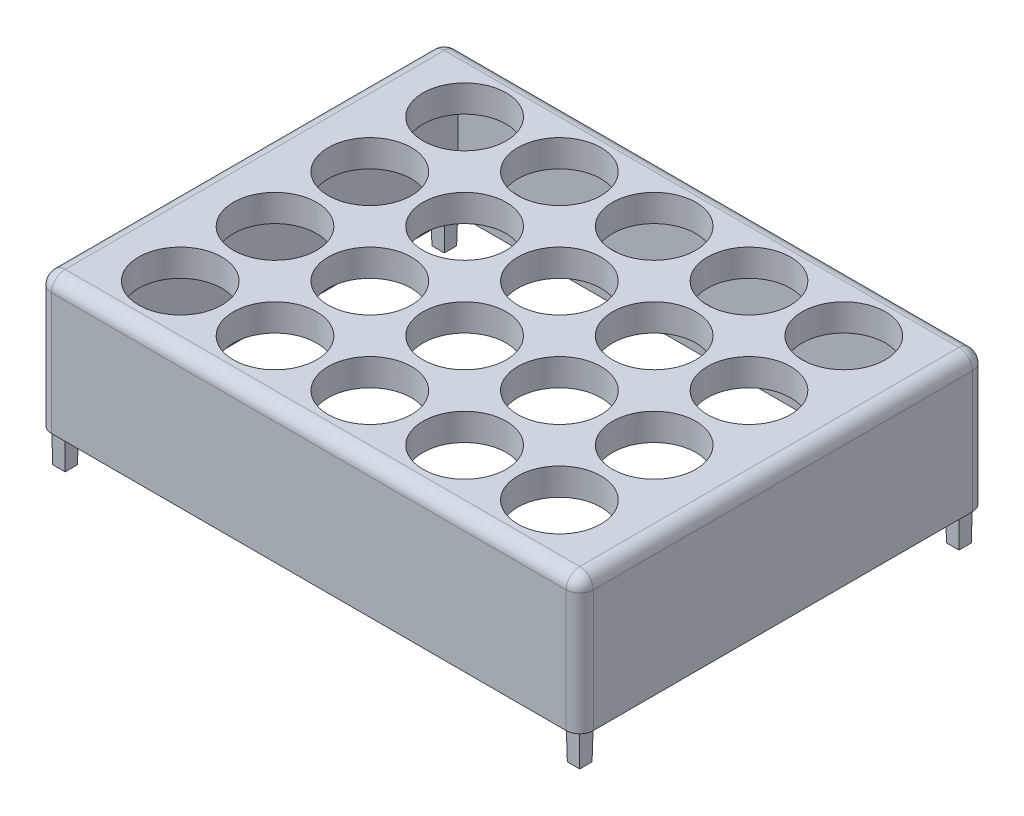
from build123d import *

# Parameters (mm, degrees)
SKETCH1_W                 = 101.6
SKETCH1_H                 = 76.2
BOSS_EXTRUDE1_DEPTH       = 25.4
HOLE1_OUTLINE_R           = 7.8105
HOLE1_DEPTH               = 25.4
HOLE2_OUTLINE_R           = 7.8105
HOLE2_DEPTH               = 25.4
LPATTERN1_COUNT           = 2
LPATTERN1_PITCH           = 17.78
LPATTERN1_COPY_1_SKETCH_R = 7.8105
LPATTERN1_COPY_1_DEPTH    = 25.4
LPATTERN1_COPY_2_SKETCH_R = 7.8105
LPATTERN1_COPY_2_DEPTH    = 25.4
LPATTERN2_COPY_1_SKETCH_R = 7.8105
LPATTERN2_COPY_1_DEPTH    = 25.4
LPATTERN2_COPY_2_SKETCH_R = 7.8105
LPATTERN2_COPY_2_DEPTH    = 25.4
LPATTERN2_COPY_3_SKETCH_R = 7.8105
LPATTERN2_COPY_3_DEPTH    = 25.4
LPATTERN2_COPY_4_SKETCH_R = 7.8105
LPATTERN2_COPY_4_DEPTH    = 25.4
LPATTERN2_COPY_5_SKETCH_R = 7.8105
LPATTERN2_COPY_5_DEPTH    = 25.4
LPATTERN2_COPY_6_SKETCH_R = 7.8105
LPATTERN2_COPY_6_DEPTH    = 25.4
MIRROR2_COPY_1_SKETCH_R   = 7.8105
MIRROR2_COPY_1_DEPTH      = 25.4
MIRROR2_COPY_2_SKETCH_R   = 7.8105
MIRROR2_COPY_2_DEPTH      = 25.4
MIRROR2_COPY_3_SKETCH_R   = 7.8105
MIRROR2_COPY_3_DEPTH      = 25.4
MIRROR2_COPY_4_SKETCH_R   = 7.8105
MIRROR2_COPY_4_DEPTH      = 25.4
MIRROR2_COPY_5_SKETCH_R   = 7.8105
MIRROR2_COPY_5_DEPTH      = 25.4
MIRROR2_COPY_6_SKETCH_R   = 7.8105
MIRROR2_COPY_6_DEPTH      = 25.4
MIRROR2_COPY_7_SKETCH_R   = 7.8105
MIRROR2_COPY_7_DEPTH      = 25.4
MIRROR2_COPY_8_SKETCH_R   = 7.8105
MIRROR2_COPY_8_DEPTH      = 25.4
MIRROR2_COPY_9_SKETCH_R   = 7.8105
MIRROR2_COPY_9_DEPTH      = 25.4
MIRROR2_COPY_10_SKETCH_R  = 7.8105
MIRROR2_COPY_10_DEPTH     = 25.4
MIRROR2_COPY_11_SKETCH_R  = 7.8105
MIRROR2_COPY_11_DEPTH     = 25.4
MIRROR2_COPY_12_SKETCH_R  = 7.8105
MIRROR2_COPY_12_DEPTH     = 25.4
MIRROR2_COPY_13_SKETCH_R  = 7.8105
MIRROR2_COPY_13_DEPTH     = 25.4
MIRROR2_COPY_14_SKETCH_R  = 7.8105
MIRROR2_COPY_14_DEPTH     = 25.4
SKETCH5_W                 = 91.44
SKETCH5_H                 = 71.12
CUT_EXTRUDE1_DEPTH        = 20.32
FILLET1_R                 = 2.54
SKETCH7_W                 = 2.54
SKETCH7_H                 = 2.54
BOSS_EXTRUDE2_DEPTH       = 6.35
BOSS_EXTRUDE2_TAPER       = 1
MIRROR4_COPY_1_SKETCH_W   = 2.54
MIRROR4_COPY_1_SKETCH_H   = 2.54
MIRROR4_COPY_1_DEPTH      = 6.35
MIRROR4_COPY_1_TAPER      = 1
SKETCH9_W                 = 91.44
SKETCH9_H                 = 0.762
EXTRUDE_THIN1_DEPTH       = 1.27


# Read off the part's stored shape, not the designer's step: Hole1, Hole2
with BuildPart() as part:
    # Sketch1 → Boss-Extrude1 (new body)
    with BuildSketch(Plane(origin=(0, 0, 0), x_dir=(1, 0, 0), z_dir=(0, 1, 0))):
        Rectangle(SKETCH1_W, SKETCH1_H)
    extrude(amount=BOSS_EXTRUDE1_DEPTH)

    # Hole1 outline → Hole1 (cut)
    with BuildSketch(Plane(origin=(0, 0, 0), x_dir=(1, 0, 0), z_dir=(0, 1, 0))):
        with Locations((0, -8.89)):
            Circle(HOLE1_OUTLINE_R)
    hole1 = extrude(amount=HOLE1_DEPTH, mode=Mode.SUBTRACT)

    # Hole2 outline → Hole2 (cut)
    with BuildSketch(Plane(origin=(0, 0, 0), x_dir=(1, 0, 0), z_dir=(0, 1, 0))):
        with Locations((0, -26.67)):
            Circle(HOLE2_OUTLINE_R)
    hole2 = extrude(amount=HOLE2_DEPTH, mode=Mode.SUBTRACT)

    # Mirror1: Hole1, Hole2 across plane
    add(hole1.mirror(Plane.XY), mode=Mode.SUBTRACT)
    add(hole2.mirror(Plane.XY), mode=Mode.SUBTRACT)

    # LPattern1: Hole1, Hole2 ×2
    with Locations(*[(-i * LPATTERN1_PITCH, 0, 0) for i in range(1, LPATTERN1_COUNT)]):
        add(hole1, mode=Mode.SUBTRACT)
        add(hole2, mode=Mode.SUBTRACT)

    # LPattern1 copy 1 sketch → LPattern1 copy 1 (cut)
    with BuildSketch(Plane(origin=(-17.78, 0, 0), x_dir=(1, 0, 0), z_dir=(0, 1, 0))):
        with Locations((0, 8.89)):
            Circle(LPATTERN1_COPY_1_SKETCH_R)
    extrude(amount=LPATTERN1_COPY_1_DEPTH, mode=Mode.SUBTRACT)

    # LPattern1 copy 2 sketch → LPattern1 copy 2 (cut)
    with BuildSketch(Plane(origin=(-17.78, 0, 0), x_dir=(1, 0, 0), z_dir=(0, 1, 0))):
        with Locations((0, 26.67)):
            Circle(LPATTERN1_COPY_2_SKETCH_R)
    extrude(amount=LPATTERN1_COPY_2_DEPTH, mode=Mode.SUBTRACT)

    # LPattern2 copy 1 sketch → LPattern2 copy 1 (cut)
    with BuildSketch(Plane(origin=(-35.56, 0, 0), x_dir=(1, 0, 0), z_dir=(0, 1, 0))):
        with Locations((0, -8.89)):
            Circle(LPATTERN2_COPY_1_SKETCH_R)
    extrude(amount=LPATTERN2_COPY_1_DEPTH, mode=Mode.SUBTRACT)

    # LPattern2 copy 2 sketch → LPattern2 copy 2 (cut)
    with BuildSketch(Plane(origin=(-35.56, 0, 0), x_dir=(1, 0, 0), z_dir=(0, 1, 0))):
        with Locations((0, -26.67)):
            Circle(LPATTERN2_COPY_2_SKETCH_R)
    extrude(amount=LPATTERN2_COPY_2_DEPTH, mode=Mode.SUBTRACT)

    # LPattern2 copy 3 sketch → LPattern2 copy 3 (cut)
    with BuildSketch(Plane(origin=(-35.56, 0, 0), x_dir=(1, 0, 0), z_dir=(0, 1, 0))):
        with Locations((0, 8.89)):
            Circle(LPATTERN2_COPY_3_SKETCH_R)
    extrude(amount=LPATTERN2_COPY_3_DEPTH, mode=Mode.SUBTRACT)

    # LPattern2 copy 4 sketch → LPattern2 copy 4 (cut)
    with BuildSketch(Plane(origin=(-35.56, 0, 0), x_dir=(1, 0, 0), z_dir=(0, 1, 0))):
        with Locations((0, 26.67)):
            Circle(LPATTERN2_COPY_4_SKETCH_R)
    extrude(amount=LPATTERN2_COPY_4_DEPTH, mode=Mode.SUBTRACT)

    # LPattern2 copy 5 sketch → LPattern2 copy 5 (cut)
    with BuildSketch(Plane(origin=(-17.78, 0, 0), x_dir=(1, 0, 0), z_dir=(0, 1, 0))):
        with Locations((0, -8.89)):
            Circle(LPATTERN2_COPY_5_SKETCH_R)
    extrude(amount=LPATTERN2_COPY_5_DEPTH, mode=Mode.SUBTRACT)

    # LPattern2 copy 6 sketch → LPattern2 copy 6 (cut)
    with BuildSketch(Plane(origin=(-17.78, 0, 0), x_dir=(1, 0, 0), z_dir=(0, 1, 0))):
        with Locations((0, -26.67)):
            Circle(LPATTERN2_COPY_6_SKETCH_R)
    extrude(amount=LPATTERN2_COPY_6_DEPTH, mode=Mode.SUBTRACT)

    # Mirror2 copy 1 sketch → Mirror2 copy 1 (cut)
    with BuildSketch(Plane(origin=(17.78, 0, 0), x_dir=(-1, 0, 0), z_dir=(0, 1, 0))):
        with Locations((0, 8.89)):
            Circle(MIRROR2_COPY_1_SKETCH_R)
    extrude(amount=MIRROR2_COPY_1_DEPTH, mode=Mode.SUBTRACT)

    # Mirror2 copy 2 sketch → Mirror2 copy 2 (cut)
    with BuildSketch(Plane(origin=(17.78, 0, 0), x_dir=(-1, 0, 0), z_dir=(0, 1, 0))):
        with Locations((0, 26.67)):
            Circle(MIRROR2_COPY_2_SKETCH_R)
    extrude(amount=MIRROR2_COPY_2_DEPTH, mode=Mode.SUBTRACT)

    # Mirror2 copy 3 sketch → Mirror2 copy 3 (cut)
    with BuildSketch(Plane(origin=(17.78, 0, 0), x_dir=(-1, 0, 0), z_dir=(0, 1, 0))):
        with Locations((0, -8.89)):
            Circle(MIRROR2_COPY_3_SKETCH_R)
    extrude(amount=MIRROR2_COPY_3_DEPTH, mode=Mode.SUBTRACT)

    # Mirror2 copy 4 sketch → Mirror2 copy 4 (cut)
    with BuildSketch(Plane(origin=(17.78, 0, 0), x_dir=(-1, 0, 0), z_dir=(0, 1, 0))):
        with Locations((0, -26.67)):
            Circle(MIRROR2_COPY_4_SKETCH_R)
    extrude(amount=MIRROR2_COPY_4_DEPTH, mode=Mode.SUBTRACT)

    # Mirror2 copy 5 sketch → Mirror2 copy 5 (cut)
    with BuildSketch(Plane(origin=(0, 0, 0), x_dir=(-1, 0, 0), z_dir=(0, 1, 0))):
        with Locations((0, 8.89)):
            Circle(MIRROR2_COPY_5_SKETCH_R)
    extrude(amount=MIRROR2_COPY_5_DEPTH, mode=Mode.SUBTRACT)

    # Mirror2 copy 6 sketch → Mirror2 copy 6 (cut)
    with BuildSketch(Plane(origin=(0, 0, 0), x_dir=(-1, 0, 0), z_dir=(0, 1, 0))):
        with Locations((0, 26.67)):
            Circle(MIRROR2_COPY_6_SKETCH_R)
    extrude(amount=MIRROR2_COPY_6_DEPTH, mode=Mode.SUBTRACT)

    # Mirror2 copy 7 sketch → Mirror2 copy 7 (cut)
    with BuildSketch(Plane(origin=(35.56, 0, 0), x_dir=(-1, 0, 0), z_dir=(0, 1, 0))):
        with Locations((0, 8.89)):
            Circle(MIRROR2_COPY_7_SKETCH_R)
    extrude(amount=MIRROR2_COPY_7_DEPTH, mode=Mode.SUBTRACT)

    # Mirror2 copy 8 sketch → Mirror2 copy 8 (cut)
    with BuildSketch(Plane(origin=(35.56, 0, 0), x_dir=(-1, 0, 0), z_dir=(0, 1, 0))):
        with Locations((0, 26.67)):
            Circle(MIRROR2_COPY_8_SKETCH_R)
    extrude(amount=MIRROR2_COPY_8_DEPTH, mode=Mode.SUBTRACT)

    # Mirror2 copy 9 sketch → Mirror2 copy 9 (cut)
    with BuildSketch(Plane(origin=(35.56, 0, 0), x_dir=(-1, 0, 0), z_dir=(0, 1, 0))):
        with Locations((0, -8.89)):
            Circle(MIRROR2_COPY_9_SKETCH_R)
    extrude(amount=MIRROR2_COPY_9_DEPTH, mode=Mode.SUBTRACT)

    # Mirror2 copy 10 sketch → Mirror2 copy 10 (cut)
    with BuildSketch(Plane(origin=(35.56, 0, 0), x_dir=(-1, 0, 0), z_dir=(0, 1, 0))):
        with Locations((0, -26.67)):
            Circle(MIRROR2_COPY_10_SKETCH_R)
    extrude(amount=MIRROR2_COPY_10_DEPTH, mode=Mode.SUBTRACT)

    # Mirror2 copy 11 sketch → Mirror2 copy 11 (cut)
    with BuildSketch(Plane(origin=(17.78, 0, 0), x_dir=(-1, 0, 0), z_dir=(0, 1, 0))):
        with Locations((0, 8.89)):
            Circle(MIRROR2_COPY_11_SKETCH_R)
    extrude(amount=MIRROR2_COPY_11_DEPTH, mode=Mode.SUBTRACT)

    # Mirror2 copy 12 sketch → Mirror2 copy 12 (cut)
    with BuildSketch(Plane(origin=(17.78, 0, 0), x_dir=(-1, 0, 0), z_dir=(0, 1, 0))):
        with Locations((0, 26.67)):
            Circle(MIRROR2_COPY_12_SKETCH_R)
    extrude(amount=MIRROR2_COPY_12_DEPTH, mode=Mode.SUBTRACT)

    # Mirror2 copy 13 sketch → Mirror2 copy 13 (cut)
    with BuildSketch(Plane(origin=(0, 0, 0), x_dir=(-1, 0, 0), z_dir=(0, 1, 0))):
        with Locations((0, 8.89)):
            Circle(MIRROR2_COPY_13_SKETCH_R)
    extrude(amount=MIRROR2_COPY_13_DEPTH, mode=Mode.SUBTRACT)

    # Mirror2 copy 14 sketch → Mirror2 copy 14 (cut)
    with BuildSketch(Plane(origin=(0, 0, 0), x_dir=(-1, 0, 0), z_dir=(0, 1, 0))):
        with Locations((0, 26.67)):
            Circle(MIRROR2_COPY_14_SKETCH_R)
    extrude(amount=MIRROR2_COPY_14_DEPTH, mode=Mode.SUBTRACT)

    # Sketch5 → Cut-Extrude1 (cut)
    with BuildSketch(Plane.XZ):
        Rectangle(SKETCH5_W, SKETCH5_H)
    extrude(amount=-CUT_EXTRUDE1_DEPTH, mode=Mode.SUBTRACT)

    # Fillet1
    fillet1_edges = [part.edges().sort_by_distance(p)[0] for p in [
        (-50.8, 25.4, 0),
        (0, 25.4, 38.1),
        (50.8, 25.4, 0),
        (50.8, 12.7, 38.1),
        (-50.8, 12.7, 38.1),
        (-50.8, 12.7, -38.1),
        (50.8, 12.7, -38.1),
        (0, 25.4, -38.1),
    ]]
    fillet(fillet1_edges, radius=FILLET1_R)

    # Sketch7 → Boss-Extrude2 (add)
    with BuildSketch(Plane(origin=(0, 0, 0), x_dir=(-1, 0, 0), z_dir=(0, -1, 0))):
        with Locations((48.26, -35.56)):
            Rectangle(SKETCH7_W, SKETCH7_H)
    boss_extrude2 = extrude(amount=BOSS_EXTRUDE2_DEPTH, taper=BOSS_EXTRUDE2_TAPER)

    # Mirror3: Boss-Extrude2 across plane
    add(boss_extrude2.mirror(Plane(origin=(0, 0, 0), x_dir=(0, 0, 1), z_dir=(1, 0, 0))))

    # Mirror4: Boss-Extrude2 across plane
    add(boss_extrude2.mirror(Plane.XY))

    # Mirror4 copy 1 sketch → Mirror4 copy 1 (add)
    with BuildSketch(Plane.XZ):
        with Locations((48.26, -35.56)):
            Rectangle(MIRROR4_COPY_1_SKETCH_W, MIRROR4_COPY_1_SKETCH_H)
    extrude(amount=MIRROR4_COPY_1_DEPTH, taper=MIRROR4_COPY_1_TAPER)

    # Sketch9 → Extrude-Thin1 (add)
    with BuildSketch(Plane.XY.offset(-35.56)):
        with Locations((0, 8.382)):
            Rectangle(SKETCH9_W, SKETCH9_H)
    extrude_thin1 = extrude(amount=EXTRUDE_THIN1_DEPTH)

    # Mirror5: Extrude-Thin1 across plane
    add(extrude_thin1.mirror(Plane.XY))


solid = part.part
